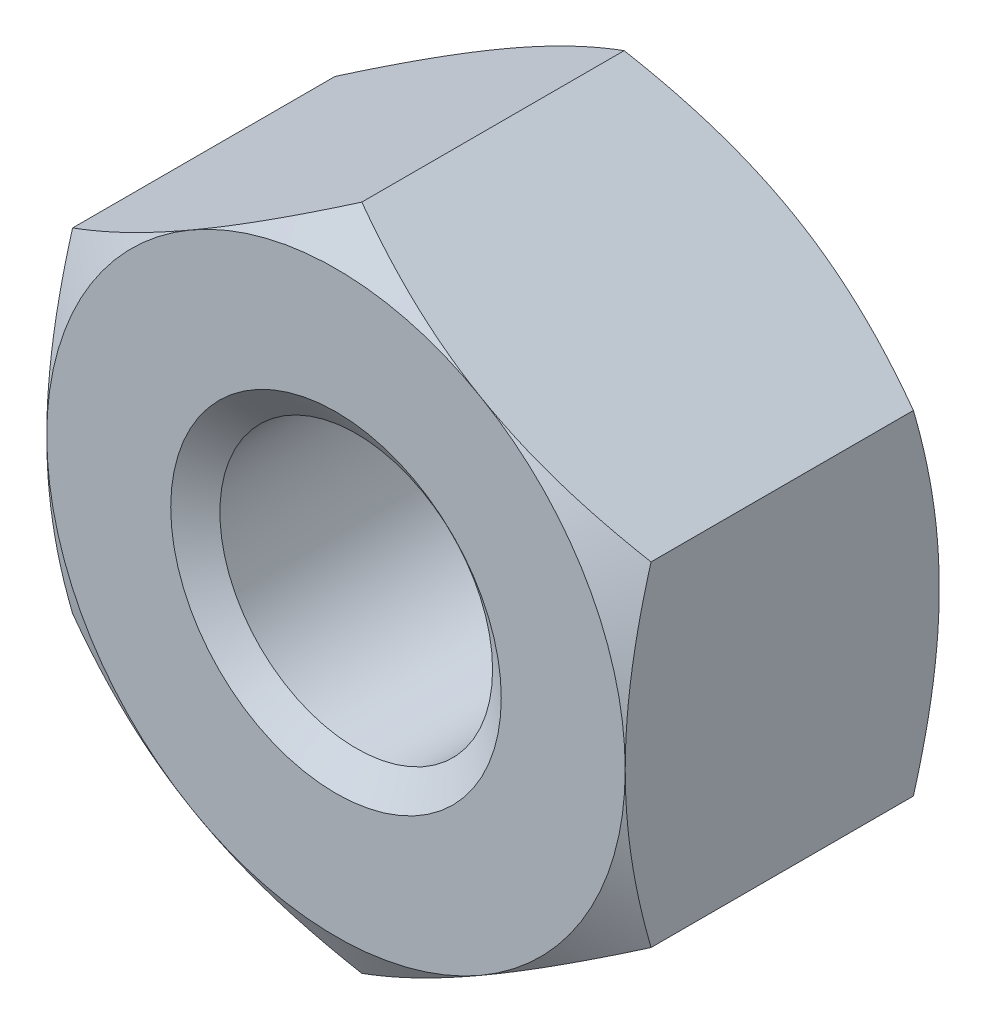
from build123d import *

# Parameters (mm, degrees)
BASENUT_START = -3.8
BASENUTSKE_R  = 1.65
BASENUT_DEPTH = 3.8


# Read off the part's stored shape, not the designer's step: ThreadSchematic
with BuildPart() as part:
    # BaseNutSke → BaseNut (new body)
    with BuildSketch(Plane.XY.offset(BASENUT_START)):
        Polygon((3.5, 2.020725942), (3.5, -2.020725942), (0, -4.041451884), (-3.5, -2.020725942), (-3.5, 2.020725942), (0, 4.041451884), align=None)
        Circle(BASENUTSKE_R, mode=Mode.SUBTRACT)
    extrude(amount=BASENUT_DEPTH)

    # Sketch5 (on Front Plane) → EndChamfer (revolve, cut)
    with BuildSketch(Plane.XY):
        Polygon((3.7746, 2), (3.505020098, 1.615), (3.8254, 1.615), (3.8254, 2), align=None)
    revolve(axis=Axis((3.7746, 2, 0), (-0.5735764363510478, -0.8191520442889905, 0)), mode=Mode.SUBTRACT)

    # Sketch3 → Double-Chamfer (revolve, cut)
    with BuildSketch(Plane(origin=(0, 0, 0), x_dir=(0, 0, -1), z_dir=(1, 0, 0))):
        Polygon((3.8, 3.5), (3.487392609, 4.041451884), (3.487392609, 14.041451884), (13.8, 14.041451884), (13.8, 3.5), align=None)
        Polygon((0.312607391, 14.041451884), (-10, 14.041451884), (-10, 3.5), (0, 3.5), (0.312607391, 4.041451884), align=None)
    revolve(axis=Axis((0, 0, 0), (0, 0, -1)), mode=Mode.SUBTRACT)

    # ThreadSchematic outline → ThreadSchematic (revolve, cut)
    with BuildSketch(Plane.XZ):
        Polygon((1.65, 0), (1.65, -0.245072638), (2, 0), align=None)
        Polygon((2, -3.7746), (1.65, -3.529527362), (1.65, -3.8), (2, -3.8), align=None)
    revolve(axis=Axis((0, 0, 0), (0, 0, 1)), mode=Mode.SUBTRACT)


solid = part.part
